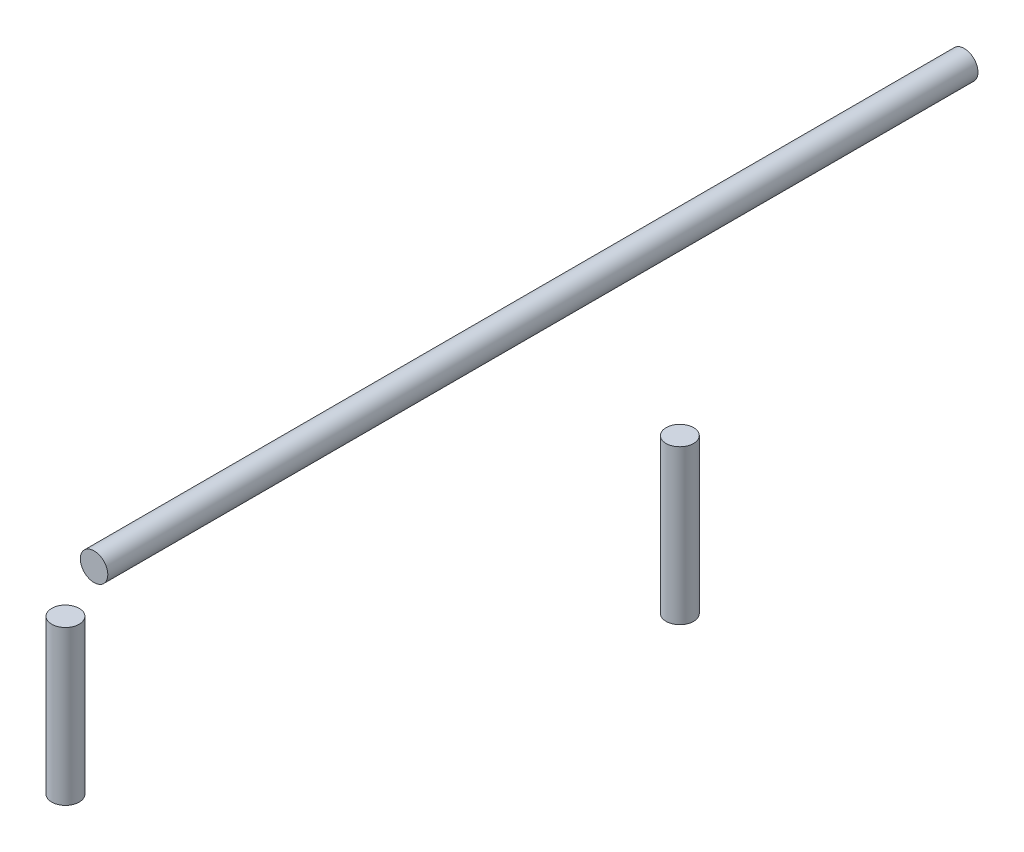
from build123d import *

# Parameters (mm, degrees)
BOSS_EXTRUDE1_OUTLINE_R = 6.35
BOSS_EXTRUDE1_DEPTH     = 71.1581
SKETCH3_R               = 6.35
BOSS_EXTRUDE2_DEPTH     = 401.828


# Read off the part's stored shape, not the designer's step: Boss-Extrude1
with BuildPart() as part:
    # Boss-Extrude1 outline → Boss-Extrude1 (new body)
    with BuildSketch(Plane(origin=(0, -84.3661, 0), x_dir=(1, 0, 0), z_dir=(0, 1, 0))):
        with Locations((0, -392.176)):
            Circle(BOSS_EXTRUDE1_OUTLINE_R)
        with Locations((69.5833, -178.054)):
            Circle(BOSS_EXTRUDE1_OUTLINE_R)
    extrude(amount=BOSS_EXTRUDE1_DEPTH)


with BuildPart() as body_2:
    # Sketch3 → Boss-Extrude2 (new body)
    with BuildSketch(Plane(origin=(0, 0, 378.968), x_dir=(-1, 0, 0), z_dir=(0, 0, -1))):
        with Locations(Location((0, 0, 0), (0, 0, 180))):
            Circle(SKETCH3_R)
    extrude(amount=BOSS_EXTRUDE2_DEPTH)


solid = Compound([part.part, body_2.part])
